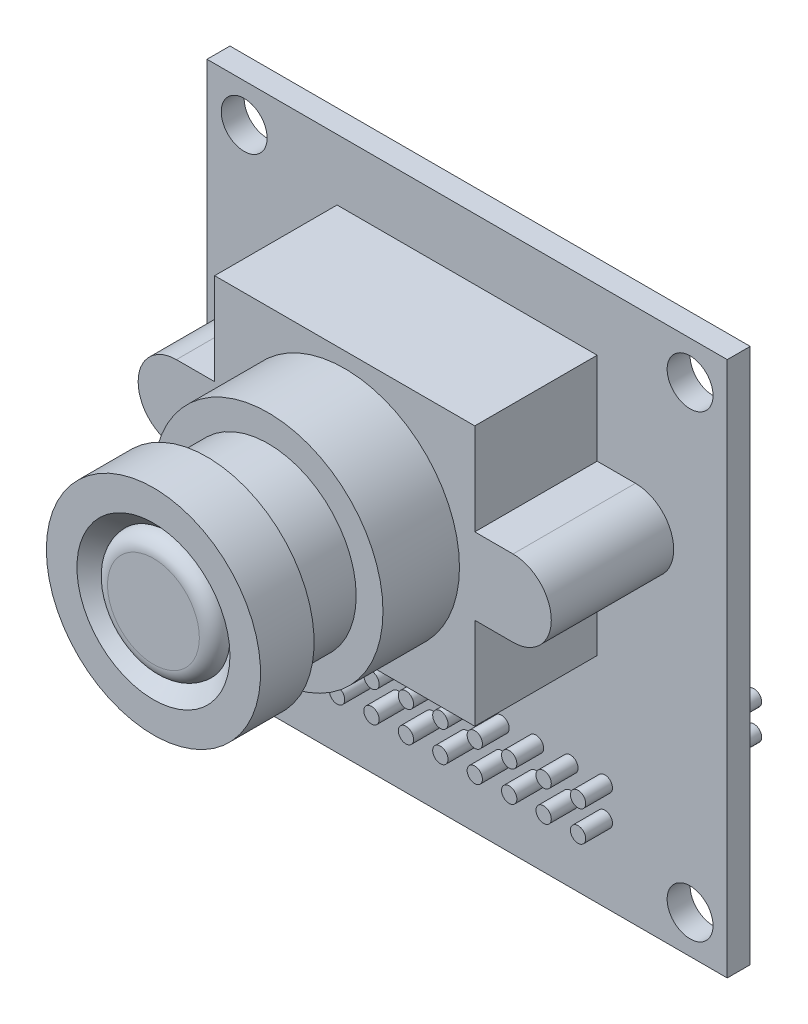
from build123d import *

# Parameters (mm, degrees)
CROQUIS1_W              = 34
CROQUIS1_H              = 35
CROQUIS1_R              = 1.5
SALIENTE_EXTRUIR1_DEPTH = 1.5
CROQUIS2_W              = 22.5
CROQUIS2_H              = 5
SALIENTE_EXTRUIR2_DEPTH = 2.5
SALIENTE_EXTRUIR3_DEPTH = 8
CROQUIS4_R              = 7.5
SALIENTE_EXTRUIR4_DEPTH = 5
CROQUIS5_R              = 5.75
SALIENTE_EXTRUIR5_DEPTH = 4
CROQUIS6_R              = 7
SALIENTE_EXTRUIR6_DEPTH = 3.5
CROQUIS7_R              = 5
CORTAR_EXTRUIR1_DEPTH   = 1
CORTAR_EXTRUIR1_DRAFT   = -45
CROQUIS8_R              = 4
SALIENTE_EXTRUIR7_DEPTH = 1
REDONDEO1_R             = 1
CROQUIS10_R             = 0.5
SALIENTE_EXTRUIR8_DEPTH = 5.75


with BuildPart() as part:
    # Croquis1 → Saliente-Extruir1 (new body)
    with BuildSketch(Plane.XY):
        Rectangle(CROQUIS1_W, CROQUIS1_H)
        with Locations((-14.571428571, 15)):
            Circle(CROQUIS1_R, mode=Mode.SUBTRACT)
        with Locations(Location((14.571428571, 15, 0), (0, 0, 180))):
            Circle(CROQUIS1_R, mode=Mode.SUBTRACT)
        with Locations((14.571428571, -15)):
            Circle(CROQUIS1_R, mode=Mode.SUBTRACT)
        with Locations(Location((-14.571428571, -15, 0), (0, 0, 180))):
            Circle(CROQUIS1_R, mode=Mode.SUBTRACT)
    extrude(amount=SALIENTE_EXTRUIR1_DEPTH)

    # Croquis2 → Saliente-Extruir2 (add)
    with BuildSketch(Plane(origin=(0, 0, 0), x_dir=(-1, 0, 0), z_dir=(0, 0, -1))):
        with Locations((0, -11.5)):
            Rectangle(CROQUIS2_W, CROQUIS2_H)
    extrude(amount=SALIENTE_EXTRUIR2_DEPTH)

    # Croquis3 → Saliente-Extruir3 (add)
    with BuildSketch(Plane.XY.offset(1.5)):
        with BuildLine():
            Line((-8.5, 13.5), (8.5, 13.5))
            Line((8.5, 13.5), (8.5, 7.5))
            Line((8.5, 7.5), (11, 7.5))
            ThreePointArc((11, 7.5), (13.5, 5), (11, 2.5))
            Line((11, 2.5), (8.5, 2.5))
            Line((8.5, 2.5), (8.5, -3.5))
            Line((8.5, -3.5), (-8.5, -3.5))
            Line((-8.5, -3.5), (-8.5, 2.5))
            Line((-8.5, 2.5), (-11, 2.5))
            ThreePointArc((-11, 2.5), (-13.5, 5), (-11, 7.5))
            Line((-11, 7.5), (-8.5, 7.5))
            Line((-8.5, 7.5), (-8.5, 13.5))
        make_face()
    extrude(amount=SALIENTE_EXTRUIR3_DEPTH)

    # Croquis4 → Saliente-Extruir4 (add)
    with BuildSketch(Plane.XY.offset(9.5)):
        with Locations((0, 5)):
            Circle(CROQUIS4_R)
    extrude(amount=SALIENTE_EXTRUIR4_DEPTH)

    # Croquis5 → Saliente-Extruir5 (add)
    with BuildSketch(Plane.XY.offset(14.5)):
        with Locations((0, 5)):
            Circle(CROQUIS5_R)
    extrude(amount=SALIENTE_EXTRUIR5_DEPTH)

    # Croquis6 → Saliente-Extruir6 (add)
    with BuildSketch(Plane.XY.offset(18.5)):
        with Locations(Location((0, 5, 0), (0, 0, 180))):
            Circle(CROQUIS6_R)
    extrude(amount=SALIENTE_EXTRUIR6_DEPTH)


with BuildPart() as cortar_extruir1_tool:
    # Croquis7 → Cortar-Extruir1 (with draft: the straight prism first)
    with BuildSketch(Plane.XY.offset(22)):
        with Locations((0, 5)):
            Circle(CROQUIS7_R)
    extrude(amount=-CORTAR_EXTRUIR1_DEPTH)
    # Cortar-Extruir1: the draft: its side faces are tilted about the plane it starts from
    cortar_extruir1_sides = [cortar_extruir1_tool.faces().sort_by_distance(p)[0] for p in [
        (-5, 5, 21.5),
    ]]
    draft(cortar_extruir1_sides, Plane.XY.offset(22), CORTAR_EXTRUIR1_DRAFT)


with BuildPart() as part_1:
    add(part.part)

    # Cortar-Extruir1: cut by cortar_extruir1_tool
    add(cortar_extruir1_tool.part, mode=Mode.SUBTRACT)

    # Croquis8 → Saliente-Extruir7 (add)
    with BuildSketch(Plane.XY.offset(21)):
        with Locations((0, 5)):
            Circle(CROQUIS8_R)
    extrude(amount=SALIENTE_EXTRUIR7_DEPTH)

    # Redondeo1
    redondeo1_edges = [part_1.edges().sort_by_distance(p)[0] for p in [
        (-4, 5, 22),
    ]]
    fillet(redondeo1_edges, radius=REDONDEO1_R - 0.0001)  # a hair under: the kernel refuses the full size

    # Croquis10 → Saliente-Extruir8 (add, symmetric)
    with BuildSketch(Plane(origin=(0, 0, -2.5), x_dir=(-1, 0, 0), z_dir=(0, 0, -1))):
        with Locations((-9, -12.5)):
            Circle(CROQUIS10_R)
        with Locations((-9, -10.5)):
            Circle(CROQUIS10_R)
        with Locations((-6.75, -10.5)):
            Circle(CROQUIS10_R)
        with Locations((-4.5, -10.5)):
            Circle(CROQUIS10_R)
        with Locations((-2.25, -10.5)):
            Circle(CROQUIS10_R)
        with Locations((0, -10.5)):
            Circle(CROQUIS10_R)
        with Locations((2.25, -10.5)):
            Circle(CROQUIS10_R)
        with Locations((4.5, -10.5)):
            Circle(CROQUIS10_R)
        with Locations((6.75, -10.5)):
            Circle(CROQUIS10_R)
        with Locations((9, -10.5)):
            Circle(CROQUIS10_R)
        with Locations((-6.75, -12.5)):
            Circle(CROQUIS10_R)
        with Locations((-4.5, -12.5)):
            Circle(CROQUIS10_R)
        with Locations((-2.25, -12.5)):
            Circle(CROQUIS10_R)
        with Locations((0, -12.5)):
            Circle(CROQUIS10_R)
        with Locations((2.25, -12.5)):
            Circle(CROQUIS10_R)
        with Locations((4.5, -12.5)):
            Circle(CROQUIS10_R)
        with Locations((6.75, -12.5)):
            Circle(CROQUIS10_R)
        with Locations((9, -12.5)):
            Circle(CROQUIS10_R)
    extrude(amount=SALIENTE_EXTRUIR8_DEPTH, both=True)


solid = part_1.part
